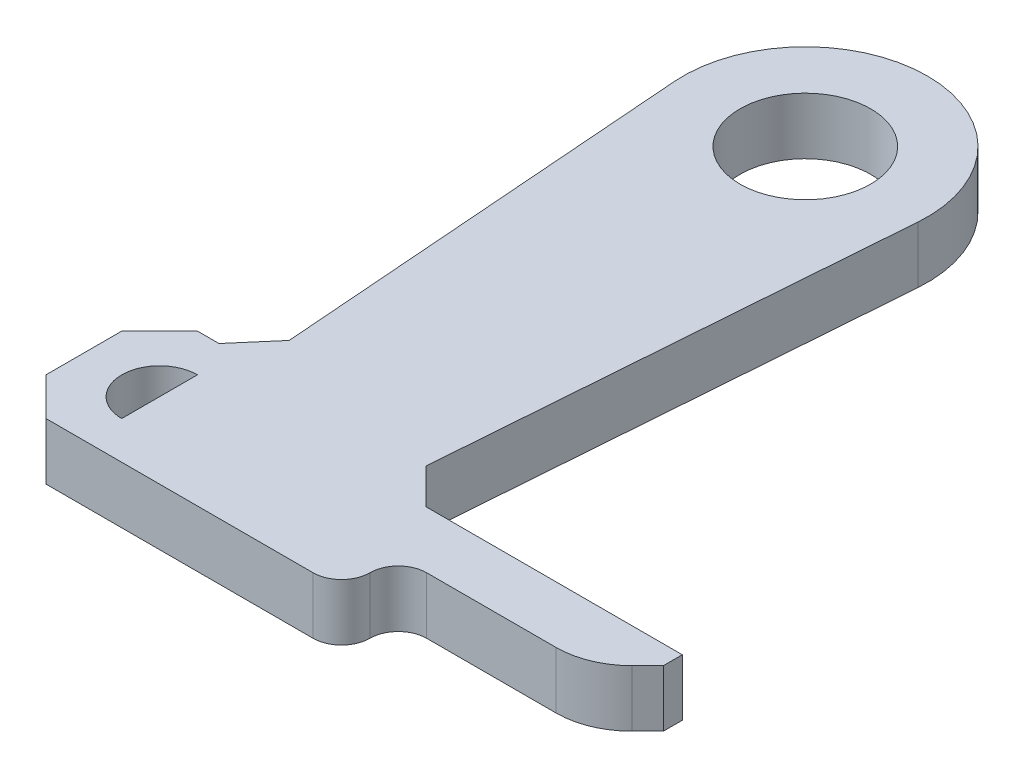
from build123d import *
from OCP.BRepFilletAPI import BRepFilletAPI_MakeChamfer, BRepFilletAPI_MakeFillet

# Parameters (mm, degrees)
SKETCH1_R               = 3.45
BOSS_EXTRUDE1_DEPTH     = 1.5
BOSS_EXTRUDE2_DEPTH     = 1.5
CUT_EXTRUDE1_DEPTH      = 36.300885258
CUT_EXTRUDE1_DEPTH_BACK = 36.300885258
SKETCH3_W               = 12
SKETCH3_H               = 3
CHAMFER5_SIZE           = 2
FILLET6_R               = 4
FILLET6_R_2             = 1.5
CHAMFER6_SIZE           = 2
CUT_EXTRUDE2_DEPTH      = 36.300885258
CUT_EXTRUDE2_DEPTH_BACK = 36.300885258
CHAMFER7_SIZE           = 2
CHAMFER7_SIZE2          = 1.864165933


with BuildPart() as part:
    # Sketch1 → Boss-Extrude1 (new, symmetric)
    with BuildSketch(Plane(origin=(0, 0, 0), x_dir=(1, 0, 0), z_dir=(0, 1, 0))):
        with BuildLine():
            Line((-4, -29.05), (-6.431473945, 2.961489101))
            ThreePointArc((-6.431473945, 2.961489101), (0, 9.9), (6.431473945, 2.961489101))
            Line((6.431473945, 2.961489101), (4, -29.05))
            Line((4, -29.05), (-4, -29.05))
        make_face()
        with Locations(Location((0, 3.45, 0), (0, 0, 270))):
            Circle(SKETCH1_R, mode=Mode.SUBTRACT)
    extrude(amount=BOSS_EXTRUDE1_DEPTH, both=True)

    # Sketch2 → Boss-Extrude2 (add, symmetric)
    with BuildSketch(Plane(origin=(0, 0, 0), x_dir=(1, 0, 0), z_dir=(0, 1, 0))):
        Polygon((-4.607650319, -21.05), (-4, -29.05), (-9.607650319, -29.05), (-9.607650319, -21.05), align=None)
        Polygon((4.455737739, -23.05), (20, -23.05), (20, -29.05), (4, -29.05), align=None)
    extrude(amount=BOSS_EXTRUDE2_DEPTH, both=True)

    # Sketch3 → Cut-Extrude1 (cut, two sides: drawn at the far end of the back side and taken through both)
    with BuildSketch(Plane(origin=(0, 0, 0), x_dir=(1, 0, 0), z_dir=(0, 1, 0)).offset(-CUT_EXTRUDE1_DEPTH_BACK)):
        with Locations((14, -27.55)):
            Rectangle(SKETCH3_W, SKETCH3_H)
    extrude(amount=CUT_EXTRUDE1_DEPTH + CUT_EXTRUDE1_DEPTH_BACK, mode=Mode.SUBTRACT)

    # Chamfer5
    chamfer5_edges = [part.edges().sort_by_distance(p)[0] for p in [
        (20, 0, 26.05),
    ]]
    chamfer(chamfer5_edges, length=CHAMFER5_SIZE)

    # Fillet6
    fillet6_edges_1 = [part.edges().sort_by_distance(p)[0] for p in [
        (18, 0, 26.05),
    ]]
    fillet6_edges_2 = [part.edges().sort_by_distance(p)[0] for p in [
        (8, 0, 26.05),
        (8, 0, 29.05),
    ]]
    fillet6 = BRepFilletAPI_MakeFillet(part.part.solid().wrapped)
    for e in fillet6_edges_1:
        fillet6.Add(FILLET6_R - 0.0001, e.wrapped)
    for e in fillet6_edges_2:
        fillet6.Add(FILLET6_R_2 - 0.0001, e.wrapped)
    add(Compound.cast(fillet6.Shape()), mode=Mode.REPLACE)  # a hair under: the kernel refuses the full size

    # Chamfer6
    chamfer6_edges = [part.edges().sort_by_distance(p)[0] for p in [
        (-9.607650319, 0, 21.05),
        (-9.607650319, 0, 29.05),
    ]]
    chamfer(chamfer6_edges, length=CHAMFER6_SIZE)

    # Sketch4 → Cut-Extrude2 (cut, two sides: drawn at the far end of the back side and taken through both)
    with BuildSketch(Plane(origin=(0, 0, 0), x_dir=(1, 0, 0), z_dir=(0, 1, 0)).offset(-CUT_EXTRUDE2_DEPTH_BACK)):
        with BuildLine():
            Line((-5.607650319, -23.05), (-5.607650319, -27.05))
            ThreePointArc((-5.607650319, -27.05), (-7.607650319, -25.05), (-5.607650319, -23.05))
        make_face()
    extrude(amount=CUT_EXTRUDE2_DEPTH + CUT_EXTRUDE2_DEPTH_BACK, mode=Mode.SUBTRACT)

    # Chamfer7: one chamfer whose edges measure the first distance from different faces: ONE call of the kernel's chamfer builder (chamfer() names one face for all edges)
    chamfer7_edges_1 = [part.edges().sort_by_distance(p)[0] for p in [
        (4.455737739, 0, 23.05),
    ]]
    chamfer7_side_1 = [part.faces().sort_by_distance(p)[0] for p in [
        (12.22786887, 0, 23.05),
    ]]
    chamfer7_edges_2 = [part.edges().sort_by_distance(p)[0] for p in [
        (-4.607650319, 0, 21.05),
    ]]
    chamfer7_side_2 = [part.faces().sort_by_distance(p)[0] for p in [
        (-5.519562132, 0, 9.04425545),
    ]]
    chamfer7 = BRepFilletAPI_MakeChamfer(part.part.solid().wrapped)
    for e in chamfer7_edges_1:
        chamfer7.Add(CHAMFER7_SIZE, CHAMFER7_SIZE2, e.wrapped, chamfer7_side_1[0].wrapped)  # the first distance lies on this face
    for e in chamfer7_edges_2:
        chamfer7.Add(CHAMFER7_SIZE, CHAMFER7_SIZE2, e.wrapped, chamfer7_side_2[0].wrapped)  # the first distance lies on this face
    add(Compound.cast(chamfer7.Shape()), mode=Mode.REPLACE)


solid = part.part
